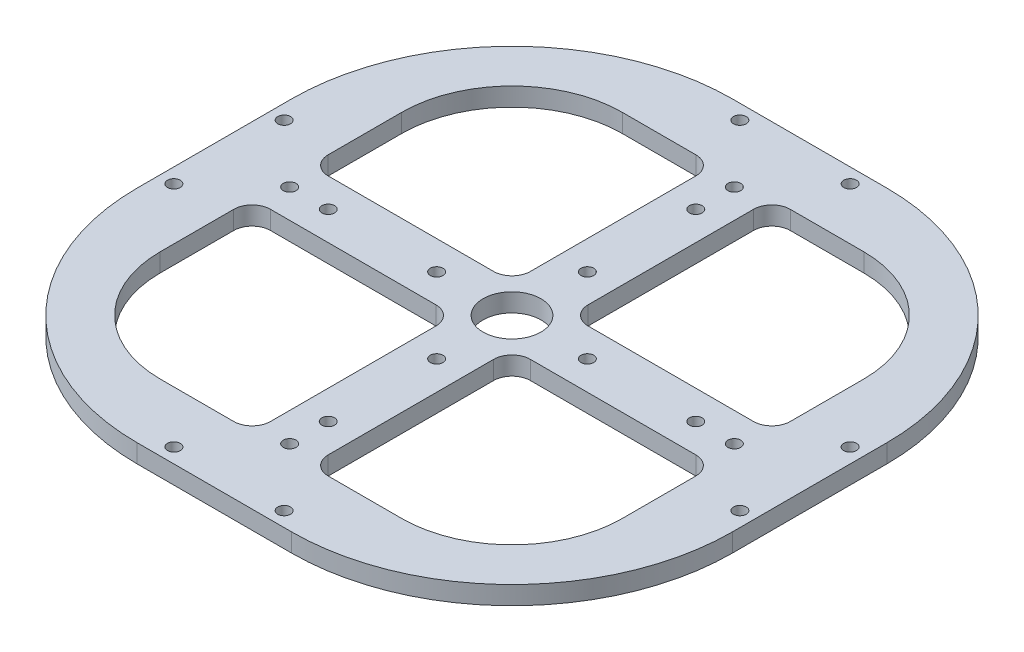
from build123d import *

# Parameters (mm, degrees)
SKETCH1_W                = 205.74
SKETCH1_H                = 205.74
SKETCH1_R                = 2.200000045
BOSS_EXTRUDE1_DEPTH      = 6.35
SKETCH3_R                = 9.999999939
CUT_EXTRUDE2_DEPTH       = 146.618667416
SKETCH4_W                = 69.85
SKETCH4_H                = 69.85
CUT_EXTRUDE3_DEPTH       = 146.618667416
FILLET4_R                = 6.35
CIRPATTERN6_COUNT        = 4
FILLET4_OF_CIRPATTERN6_R = 6.35
FILLET8_R                = 38.1
FILLET9_R                = 76.2
SKETCH10_R               = 2.200000045
CUT_EXTRUDE6_DEPTH       = 146.618667416
SKETCH11_R               = 4.000000001
CUT_EXTRUDE7_DEPTH       = 3.000000096
CIRPATTERN4_COUNT        = 4


with BuildPart() as part:
    # Sketch1 → Boss-Extrude1 (new body)
    with BuildSketch(Plane(origin=(0, 0, 0), x_dir=(1, 0, 0), z_dir=(0, 1, 0))):
        Rectangle(SKETCH1_W, SKETCH1_H)
        with Locations((63.5, 0)):
            Circle(SKETCH1_R, mode=Mode.SUBTRACT)
        with Locations((0, -63.5)):
            Circle(SKETCH1_R, mode=Mode.SUBTRACT)
        with Locations((-63.5, 0)):
            Circle(SKETCH1_R, mode=Mode.SUBTRACT)
        with Locations((0, 63.5)):
            Circle(SKETCH1_R, mode=Mode.SUBTRACT)
    extrude(amount=BOSS_EXTRUDE1_DEPTH)

    # Sketch3 → Cut-Extrude2 (cut, through all)
    with BuildSketch(Plane(origin=(0, 6.35, 0), x_dir=(1, 0, 0), z_dir=(0, 1, 0))):
        Circle(SKETCH3_R)
    extrude(amount=-CUT_EXTRUDE2_DEPTH, mode=Mode.SUBTRACT)

    # Sketch4 → Cut-Extrude3 (cut, through all)
    with BuildSketch(Plane(origin=(0, 6.35, 0), x_dir=(1, 0, 0), z_dir=(0, 1, 0))):
        with Locations((-44.901280605, 44.901280605)):
            Rectangle(SKETCH4_W, SKETCH4_H)
    cut_extrude3 = extrude(amount=-CUT_EXTRUDE3_DEPTH, mode=Mode.SUBTRACT)

    # Fillet4
    fillet4_edges = [part.edges().sort_by_distance(p)[0] for p in [
        (-9.976280605, 3.175, -79.826280605),
        (-9.976280605, 3.175, -9.976280605),
        (-79.826280605, 3.175, -9.976280605),
    ]]
    fillet(fillet4_edges, radius=FILLET4_R)

    # CirPattern6: Cut-Extrude3 ×4 about axis
    cirpattern6_axis = Axis((0, 0, 0), (0, 1, 0))
    for i in range(1, CIRPATTERN6_COUNT):
        add(cut_extrude3.rotate(cirpattern6_axis, i * 360 / CIRPATTERN6_COUNT), mode=Mode.SUBTRACT)

    # Fillet4 of CirPattern6
    fillet4_of_cirpattern6_edges = [part.edges().sort_by_distance(p)[0] for p in [
        (-79.826280605, 3.175, 9.976280605),
        (-9.976280605, 3.175, 9.976280605),
        (-9.976280605, 3.175, 79.826280605),
        (9.976280605, 3.175, 79.826280605),
        (9.976280605, 3.175, 9.976280605),
        (79.826280605, 3.175, 9.976280605),
        (79.826280605, 3.175, -9.976280605),
        (9.976280605, 3.175, -9.976280605),
        (9.976280605, 3.175, -79.826280605),
    ]]
    fillet(fillet4_of_cirpattern6_edges, radius=FILLET4_OF_CIRPATTERN6_R)

    # Fillet8
    fillet8_edges = [part.edges().sort_by_distance(p)[0] for p in [
        (-79.826280605, 3.175, 79.826280605),
        (79.826280605, 3.175, 79.826280605),
        (79.826280605, 3.175, -79.826280605),
        (-79.826280605, 3.175, -79.826280605),
    ]]
    fillet(fillet8_edges, radius=FILLET8_R)

    # Fillet9
    fillet9_edges = [part.edges().sort_by_distance(p)[0] for p in [
        (102.87, 3.175, 102.87),
        (102.87, 3.175, -102.87),
        (-102.87, 3.175, -102.87),
        (-102.87, 3.175, 102.87),
    ]]
    fillet(fillet9_edges, radius=FILLET9_R)

    # Sketch10 → Cut-Extrude6 (cut, through all)
    with BuildSketch(Plane(origin=(0, 6.35, 0), x_dir=(1, 0, 0), z_dir=(0, 1, 0))):
        with Locations((0, -26.035)):
            Circle(SKETCH10_R)
        with Locations((0, -76.835)):
            Circle(SKETCH10_R)
        with Locations((-19.05, -97.79)):
            Circle(SKETCH10_R)
        with Locations((19.05, -97.79)):
            Circle(SKETCH10_R)
    cut_extrude6 = extrude(amount=-CUT_EXTRUDE6_DEPTH, mode=Mode.SUBTRACT)

    # Sketch11 → Cut-Extrude7 (cut)
    with BuildSketch(Plane.XZ):
        with Locations((-19.05, 97.79)):
            Circle(SKETCH11_R)
        with Locations((19.05, 97.79)):
            Circle(SKETCH11_R)
        with Locations((0, 76.835)):
            Circle(SKETCH11_R)
        with Locations((0, 26.035)):
            Circle(SKETCH11_R)
    cut_extrude7 = extrude(amount=-CUT_EXTRUDE7_DEPTH, mode=Mode.SUBTRACT)

    # CirPattern4: Cut-Extrude6, Cut-Extrude7 ×4 about axis
    cirpattern4_axis = Axis((0, 0, 0), (0, 1, 0))
    add([cut_extrude6.rotate(cirpattern4_axis, i * 360 / CIRPATTERN4_COUNT) for i in range(1, CIRPATTERN4_COUNT)], mode=Mode.SUBTRACT)
    add([cut_extrude7.rotate(cirpattern4_axis, i * 360 / CIRPATTERN4_COUNT) for i in range(1, CIRPATTERN4_COUNT)], mode=Mode.SUBTRACT)


solid = part.part
